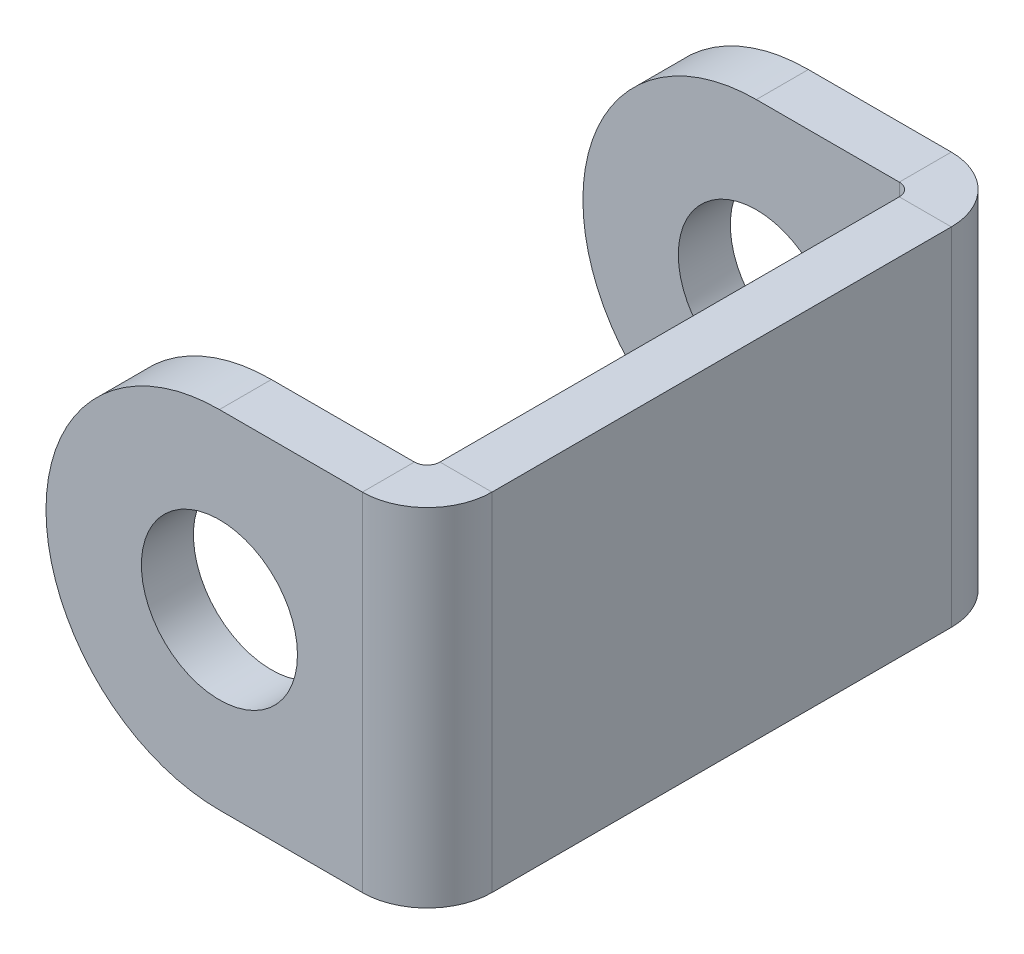
from build123d import *

# Parameters (mm, degrees)
SKETCH1_W              = 70
SKETCH1_H              = 20
BASE_FLANGE1_DEPTH     = 3
SKETCHED_BEND1_DEPTH   = 20
SKETCHED_BEND1_2_DEPTH = 20
FILLET1_R              = 10
SKETCH10_R             = 4.5
CUT_EXTRUDE1_DEPTH     = 46.126468159


# Read off the part's stored shape, not the designer's step: Sketched Bend1
# Sheet-metal steps are written as plain solids
with BuildPart() as part:
    # Sketch1 → Base-Flange1 (new body)
    with BuildSketch(Plane.XY):
        with Locations((35, 10)):
            Rectangle(SKETCH1_W, SKETCH1_H)
    extrude(amount=-BASE_FLANGE1_DEPTH)

    # Sketched Bend1 outline → Sketched Bend1 (cut)
    with BuildSketch(Plane(origin=(0, 0, 0), x_dir=(1, 0, 0), z_dir=(0, 1, 0))):
        with BuildLine():
            ThreePointArc((18.243378468, 3), (20.610845469, 2.154295979), (21.906655689, 0))
            Line((21.906655689, 0), (70, 0))
            Line((70, 0), (70, 3))
            Line((70, 3), (18.243378468, 3))
        make_face()
    extrude(amount=SKETCHED_BEND1_DEPTH, mode=Mode.SUBTRACT)

    # Sketched Bend1 2 outline → Sketched Bend1 2 (add)
    with BuildSketch(Plane(origin=(0, 0, 0), x_dir=(1, 0, 0), z_dir=(0, 1, 0))):
        with BuildLine():
            Line((18.979978468, -0.7366), (18.979978468, -27.223356935))
            ThreePointArc((18.979978468, -27.223356935), (18.764233323, -27.74421179), (18.243378468, -27.959956935))
            Line((18.243378468, -27.959956935), (0, -27.959956935))
            Line((0, -27.959956935), (0, -30.959956935))
            Line((0, -30.959956935), (18.243378468, -30.959956935))
            ThreePointArc((18.243378468, -30.959956935), (20.885553666, -29.865532134), (21.979978468, -27.223356935))
            Line((21.979978468, -27.223356935), (21.979978468, -0.7366))
            ThreePointArc((21.979978468, -0.7366), (21.961602589, -0.36647982), (21.906655689, 0))
            Line((21.906655689, 0), (18.243378468, 0))
            ThreePointArc((18.243378468, 0), (18.764233323, -0.215745145), (18.979978468, -0.7366))
        make_face()
    extrude(amount=SKETCHED_BEND1_2_DEPTH)

    # Fillet1
    fillet1_edges = [part.edges().sort_by_distance(p)[0] for p in [
        (0, 0, 29.459956935),
        (0, 0, -1.5),
        (0, 20, 29.459956935),
        (0, 20, -1.5),
    ]]
    fillet(fillet1_edges, radius=FILLET1_R - 0.0001)  # a hair under: the kernel refuses the full size

    # Sketch10 → Cut-Extrude1 (cut, through all)
    with BuildSketch(Plane.XY.offset(30.959956935)):
        with Locations((10, 10)):
            Circle(SKETCH10_R)
    extrude(amount=-CUT_EXTRUDE1_DEPTH, mode=Mode.SUBTRACT)


solid = part.part
